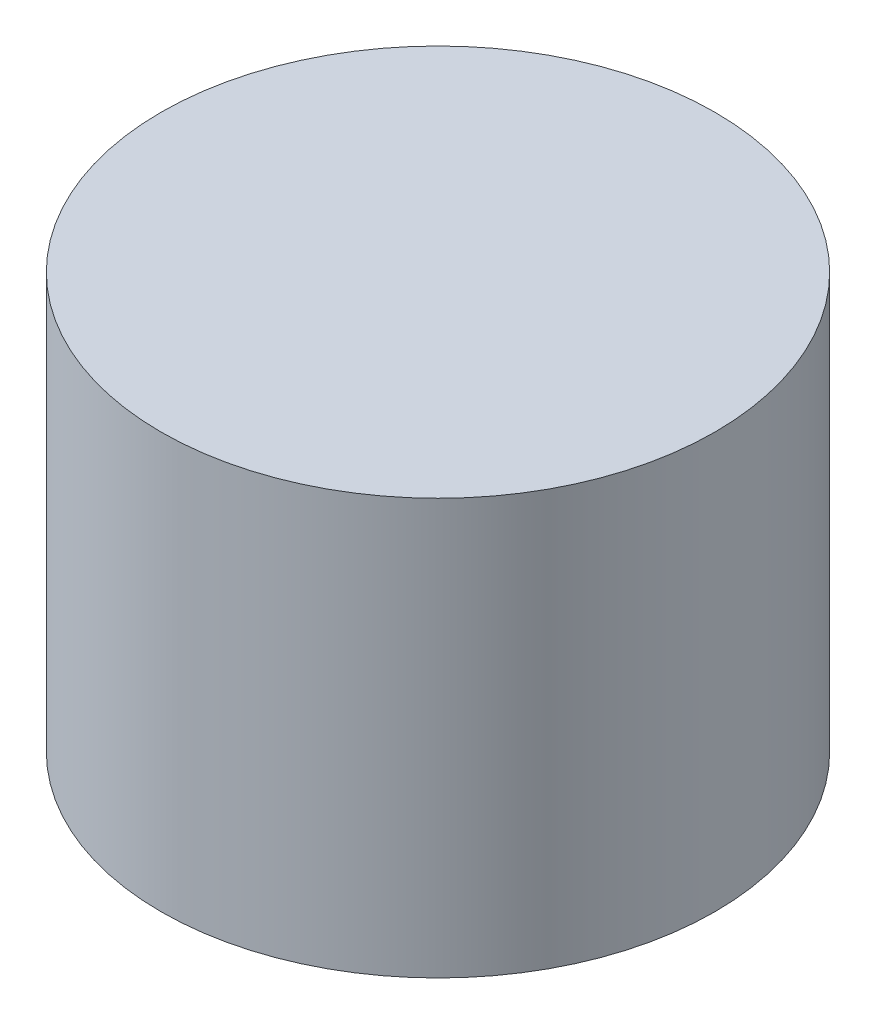
from build123d import *

# Parameters (mm, degrees)
SKETCH1_R           = 2
BOSS_EXTRUDE1_DEPTH = 3


with BuildPart() as part:
    # Sketch1 → Boss-Extrude1 (new body)
    with BuildSketch(Plane(origin=(0, 0, 0), x_dir=(1, 0, 0), z_dir=(0, 1, 0))):
        Circle(SKETCH1_R)
    extrude(amount=BOSS_EXTRUDE1_DEPTH)


solid = part.part
